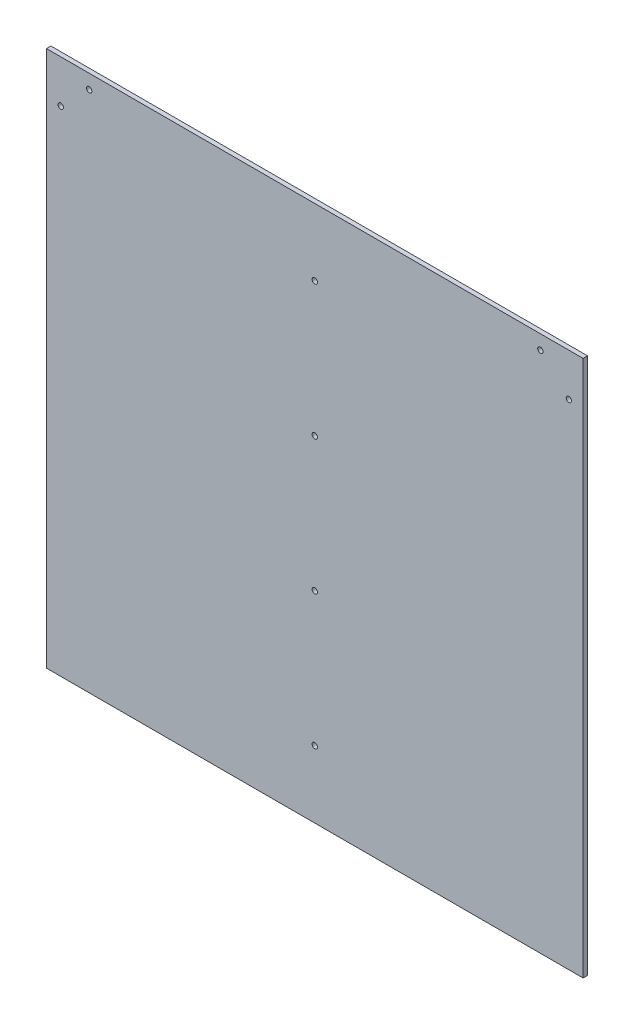
from build123d import *

# Parameters (mm, degrees)
SKETCH1_W           = 400
SKETCH1_H           = 400
BOSS_EXTRUDE1_DEPTH = 3.3
SKETCH2_R           = 2
CUT_EXTRUDE1_DEPTH  = 4


with BuildPart() as part:
    # Sketch1 → Boss-Extrude1 (new body)
    with BuildSketch(Plane.XY):
        with Locations((-27, 196.7)):
            Rectangle(SKETCH1_W, SKETCH1_H)
    extrude(amount=BOSS_EXTRUDE1_DEPTH)

    # Sketch2 → Cut-Extrude1 (cut)
    with BuildSketch(Plane.XY.offset(3.3)):
        with Locations((-27, 146.7)):
            Circle(SKETCH2_R)
        with Locations((-27, 46.7)):
            Circle(SKETCH2_R)
        with Locations((-27, 246.7)):
            Circle(SKETCH2_R)
        with Locations((-27, 346.7)):
            Circle(SKETCH2_R)
        with Locations((162.393398282, 364.880194847)):
            Circle(SKETCH2_R)
        with Locations((141.180194847, 386.093398282)):
            Circle(SKETCH2_R)
        with Locations((-195.180194847, 386.093398282)):
            Circle(SKETCH2_R)
        with Locations((-216.393398282, 364.880194847)):
            Circle(SKETCH2_R)
    extrude(amount=-CUT_EXTRUDE1_DEPTH, mode=Mode.SUBTRACT)


solid = part.part
